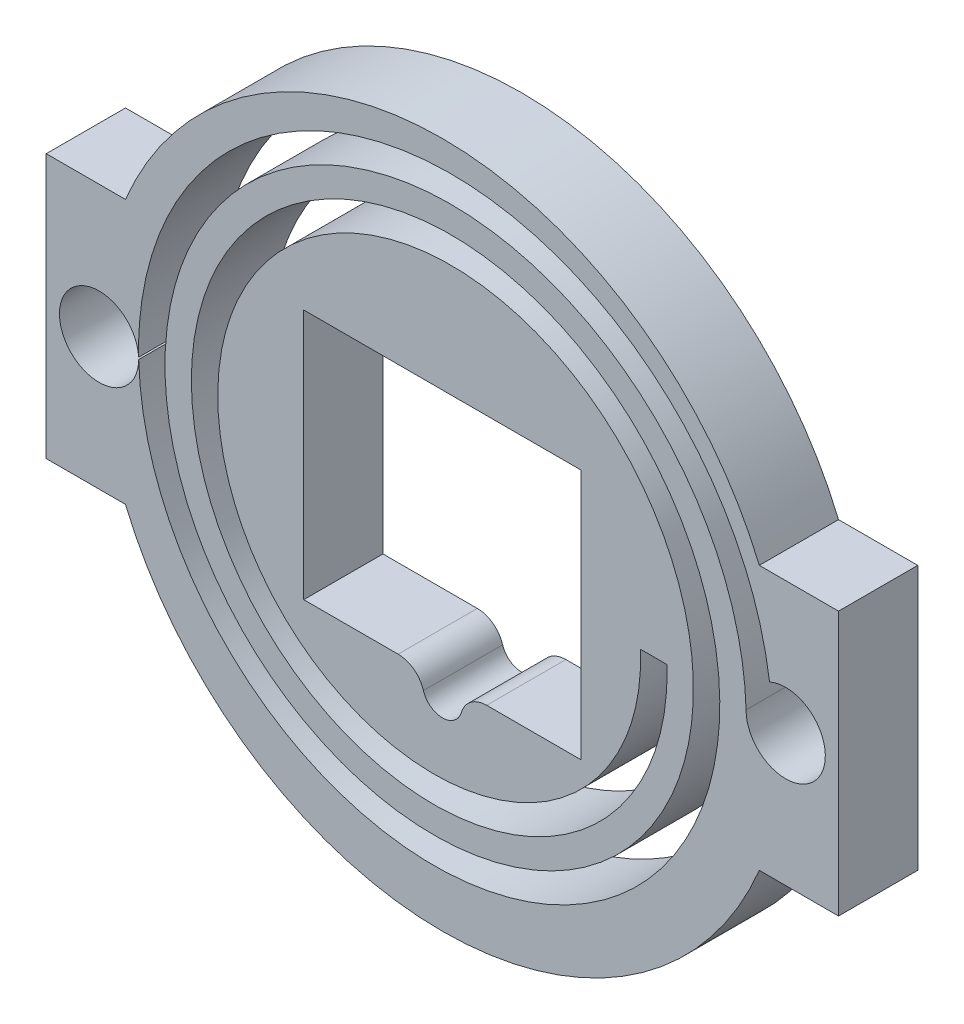
from build123d import *

# Parameters (mm, degrees)
AUFSATZ_LINEAR_AUSTRAGEN1_DEPTH = 3
SCHNITT_AUSTRAGUNG1_DEPTH       = 3
SCHNITT_LINEAR_AUSTRAGEN1_REACH = 37.114
SKIZZE4_W                       = 10.5
SKIZZE4_H                       = 9.5
SCHNITT_LINEAR_AUSTRAGEN2_REACH = 37.114
SKIZZE5_R                       = 1.5
SCHNITT_LINEAR_AUSTRAGEN3_REACH = 37.114
SKIZZE6_R                       = 0.75
VERRUNDUNG1_R                   = 1


# Read off the part's stored shape, not the designer's step: Schnitt-Austragung1
with BuildPart() as part:
    # Skizze1 → Aufsatz-Linear austragen1 (new body)
    with BuildSketch(Plane.XY):
        with BuildLine():
            Line((0, 10), (0, 0))
            Line((0, 0), (3, 0))
            ThreePointArc((3, 0), (2, 5), (3, 10))
            Line((3, 10), (0, 10))
        make_face()
        with BuildLine():
            ThreePointArc((3, 10), (2, 5), (3, 0))
            Line((3, 0), (9.409830056, 0))
            ThreePointArc((9.409830056, 0), (7.5, 5), (9.409830056, 10))
            Line((9.409830056, 10), (3, 10))
        make_face()
        with BuildLine():
            Line((20.590169944, 0), (27, 0))
            ThreePointArc((27, 0), (27.747548784, 2.450490243), (28, 5))
            ThreePointArc((28, 5), (27.747548784, 7.549509757), (27, 10))
            Line((27, 10), (20.590169944, 10))
            ThreePointArc((20.590169944, 10), (22.006292692, 7.676165673), (22.5, 5))
            ThreePointArc((22.5, 5), (22.006292692, 2.323834327), (20.590169944, 0))
        make_face()
        with BuildLine():
            ThreePointArc((27, 10), (15, 18), (3, 10))
            Line((3, 10), (9.409830056, 10))
            ThreePointArc((9.409830056, 10), (15, 12.5), (20.590169944, 10))
            Line((20.590169944, 10), (27, 10))
        make_face()
        with BuildLine():
            Line((9.409830056, 0), (3, 0))
            ThreePointArc((3, 0), (15, -8), (27, 0))
            Line((27, 0), (20.590169944, 0))
            ThreePointArc((20.590169944, 0), (15, -2.5), (9.409830056, 0))
        make_face()
        with BuildLine():
            ThreePointArc((9.409830056, 10), (7.5, 5), (9.409830056, 0))
            Line((9.409830056, 0), (20.590169944, 0))
            ThreePointArc((20.590169944, 0), (22.006292692, 2.323834327), (22.5, 5))
            ThreePointArc((22.5, 5), (22.006292692, 7.676165673), (20.590169944, 10))
            Line((20.590169944, 10), (9.409830056, 10))
        make_face()
        with BuildLine():
            ThreePointArc((28, 5), (27.747548784, 2.450490243), (27, 0))
            Line((27, 0), (30, 0))
            Line((30, 0), (30, 10))
            Line((30, 10), (27, 10))
            ThreePointArc((27, 10), (27.747548784, 7.549509757), (28, 5))
        make_face()
        with BuildLine():
            Line((20.590169944, 0), (9.409830056, 0))
            ThreePointArc((9.409830056, 0), (15, -2.5), (20.590169944, 0))
        make_face()
        with BuildLine():
            ThreePointArc((20.590169944, 10), (15, 12.5), (9.409830056, 10))
            Line((9.409830056, 10), (20.590169944, 10))
        make_face()
    extrude(amount=AUFSATZ_LINEAR_AUSTRAGEN1_DEPTH)

    # Schnitt-Austragung1 outline → Schnitt-Austragung1 (cut)
    with BuildSketch(Plane.XY):
        with BuildLine():
            add(Edge.make_bspline(
                [(23.5, 5), (23.541666666, 3.887352597), (23.362019327, 2.758369508), (22.574902609, 0.640341284), (21.967622011, -0.347821129), (20.40674666, -2.026547542), (19.453673194, -2.716359289), (17.338957731, -3.682502413), (16.178097112, -3.958333357), (13.821902888, -4.041666643), (12.627495566, -3.849005664), (10.388531793, -3.011795804), (9.344905512, -2.367455431), (7.573619036, -0.714020021), (6.846747518, 0.294517317), (5.830511247, 2.530168326), (5.541666645, 3.756453041), (5.458333355, 6.243546959), (5.664007998, 7.503378375), (6.551311001, 9.863277698), (7.232711148, 10.962367847), (8.978706619, 12.826214386), (10.042707827, 13.590145675), (12.399294384, 14.656475092), (13.691003194, 14.958333354), (16.308996806, 15.041666646), (17.634252317, 14.822978339), (20.115087188, 13.885582194), (21.269641206, 13.167122272), (23.226047808, 11.328566742), (24.027038868, 10.209101663), (25.143461431, 7.731579559), (25.458333353, 6.374446653), (25.541666647, 3.625553347), (25.309964676, 2.234873741), (24.322475389, -0.366896679), (23.566955693, -1.576914565), (21.635840103, -3.62588123), (20.460911153, -4.463932062), (17.862453501, -5.630447771), (16.4398965, -5.958333352), (13.5601035, -6.041666648), (12.103999799, -5.796951014), (9.38129383, -4.759368584), (8.115812076, -3.966789114), (5.974285348, -1.943113463), (5.099174745, -0.712720643), (3.88256589, 2.006672557), (3.541666648, 3.494653653), (3.458333352, 6.505346347), (3.716062648, 8.026874142), (4.803738221, 10.87051566), (5.633377466, 12.191461284), (7.749613176, 14.425548074), (9.035469867, 15.337718448), (11.875798614, 16.604420449), (13.429203806, 16.958333351), (16.570796194, 17.041666649), (18.157748084, 16.770923689), (21.122325151, 15.633154974), (22.498734643, 14.766455955), (24.825381496, 12.557660184), (25.774611642, 11.216339623), (27.091406788, 8.255075328), (27.458333332, 6.636246177), (27.5, 5)],
                knots=[0, 0, 0, 0, 0.03125, 0.03125, 0.0625, 0.0625, 0.09375, 0.09375, 0.125, 0.125, 0.15625, 0.15625, 0.1875, 0.1875, 0.21875, 0.21875, 0.25, 0.25, 0.28125, 0.28125, 0.3125, 0.3125, 0.34375, 0.34375, 0.375, 0.375, 0.40625, 0.40625, 0.4375, 0.4375, 0.46875, 0.46875, 0.5, 0.5, 0.53125, 0.53125, 0.5625, 0.5625, 0.59375, 0.59375, 0.625, 0.625, 0.65625, 0.65625, 0.6875, 0.6875, 0.71875, 0.71875, 0.75, 0.75, 0.78125, 0.78125, 0.8125, 0.8125, 0.84375, 0.84375, 0.875, 0.875, 0.90625, 0.90625, 0.9375, 0.9375, 0.96875, 0.96875, 1, 1, 1, 1], degree=3))
            Line((23.5, 5), (22.5, 5))
            add(Edge.make_bspline(
                [(22.5, 5), (22.541666667, 4.020137958), (22.387483723, 3.018945985), (21.702094232, 1.146133005), (21.167313725, 0.266283918), (19.794353268, -1.224928757), (18.949744294, -1.842475601), (17.080440541, -2.707419914), (16.047450739, -2.958059749), (13.956704662, -3.041944567), (12.890057775, -2.875005853), (10.896067143, -2.14000317), (9.960594365, -1.56836807), (8.376425734, -0.103188813), (7.721599213, 0.796759054), (6.806079032, 2.786838804), (6.542181359, 3.885222127), (6.457803141, 6.106903978), (6.637524543, 7.239038309), (7.42218998, 9.354180532), (8.030700632, 10.345260141), (9.588133092, 12.022343442), (10.543432262, 12.71442699), (12.654303394, 13.680473777), (13.818082942, 13.957604625), (16.170696144, 14.042426852), (17.368311264, 13.849899865), (19.604583009, 13.01552942), (20.651255119, 12.370125314), (22.421217943, 10.720410202), (23.150539197, 9.70974908), (24.167070505, 7.4780733), (24.457413426, 6.248895162), (24.542637336, 3.765354289), (24.337285112, 2.502264041), (23.453173337, 0.144881631), (22.770860366, -0.957370704), (21.028837199, -2.820182882), (19.962804919, -3.586725229), (17.610312975, -4.65370482), (16.315734165, -4.957241614), (13.701268713, -5.042830662), (12.372708195, -4.824636208), (9.894231355, -3.890751655), (8.736409395, -3.171516453), (6.780773949, -1.337163167), (5.977024901, -0.215751716), (4.859628453, 2.257566455), (4.542913591, 3.617547774), (4.456991178, 6.362935184), (4.688042655, 7.756961777), (5.671727396, 10.356518968), (6.427896492, 11.569901338), (8.354599186, 13.61833734), (9.531396824, 14.459280543), (12.125550065, 15.627066417), (13.550935526, 15.956945536), (16.427242654, 16.043173515), (17.886731672, 15.79925206), (20.607356926, 14.765743095), (21.876291645, 13.972629864), (24.017508312, 11.953560806), (24.895634664, 10.7213708), (26.113785879, 8.006374677), (26.456817405, 6.515609355), (26.500071657, 5.011971156)],
                knots=[0, 0, 0, 0, 0.03125, 0.03125, 0.0625, 0.0625, 0.09375, 0.09375, 0.125, 0.125, 0.15625, 0.15625, 0.1875, 0.1875, 0.21875, 0.21875, 0.25, 0.25, 0.28125, 0.28125, 0.3125, 0.3125, 0.34375, 0.34375, 0.375, 0.375, 0.40625, 0.40625, 0.4375, 0.4375, 0.46875, 0.46875, 0.5, 0.5, 0.53125, 0.53125, 0.5625, 0.5625, 0.59375, 0.59375, 0.625, 0.625, 0.65625, 0.65625, 0.6875, 0.6875, 0.71875, 0.71875, 0.75, 0.75, 0.78125, 0.78125, 0.8125, 0.8125, 0.84375, 0.84375, 0.875, 0.875, 0.90625, 0.90625, 0.9375, 0.9375, 0.96875, 0.96875, 1, 1, 1, 1], degree=3))
            Line((26.500071657, 5.011971156), (27.5, 5))
        make_face()
    extrude(amount=SCHNITT_AUSTRAGUNG1_DEPTH, mode=Mode.SUBTRACT)

    # Skizze4 → Schnitt-Linear austragen1 (cut, up to next)
    with BuildSketch(Plane.XY.offset(3), mode=Mode.PRIVATE) as schnitt_linear_austragen1_sk1:
        with Locations((15, 5)):
            Rectangle(SKIZZE4_W, SKIZZE4_H)
    schnitt_linear_austragen1_tool1 = extrude(schnitt_linear_austragen1_sk1.sketch, amount=-SCHNITT_LINEAR_AUSTRAGEN1_REACH, mode=Mode.PRIVATE) & part.part
    add(schnitt_linear_austragen1_tool1.solids().sort_by_distance((15, 5, 3))[0], mode=Mode.SUBTRACT)

    # Skizze5 → Schnitt-Linear austragen2 (cut, up to next)
    with BuildSketch(Plane.XY.offset(3), mode=Mode.PRIVATE) as schnitt_linear_austragen2_sk1:
        with Locations((2, 5)):
            Circle(SKIZZE5_R)
    schnitt_linear_austragen2_tool1 = extrude(schnitt_linear_austragen2_sk1.sketch, amount=-SCHNITT_LINEAR_AUSTRAGEN2_REACH, mode=Mode.PRIVATE) & part.part
    # Skizze5 → Schnitt-Linear austragen2 (cut, up to next)
    with BuildSketch(Plane.XY.offset(3), mode=Mode.PRIVATE) as schnitt_linear_austragen2_sk2:
        with Locations((28, 5)):
            Circle(SKIZZE5_R)
    schnitt_linear_austragen2_tool2 = extrude(schnitt_linear_austragen2_sk2.sketch, amount=-SCHNITT_LINEAR_AUSTRAGEN2_REACH, mode=Mode.PRIVATE) & part.part
    add(schnitt_linear_austragen2_tool1.solids().sort_by_distance((2, 5, 3))[0], mode=Mode.SUBTRACT)
    add(schnitt_linear_austragen2_tool2.solids().sort_by_distance((28, 5, 3))[0], mode=Mode.SUBTRACT)

    # Skizze6 → Schnitt-Linear austragen3 (cut, up to next)
    with BuildSketch(Plane.XY.offset(3), mode=Mode.PRIVATE) as schnitt_linear_austragen3_sk1:
        with Locations((15, -0.25)):
            Circle(SKIZZE6_R)
    schnitt_linear_austragen3_tool1 = extrude(schnitt_linear_austragen3_sk1.sketch, amount=-SCHNITT_LINEAR_AUSTRAGEN3_REACH, mode=Mode.PRIVATE) & part.part
    add(schnitt_linear_austragen3_tool1.solids().sort_by_distance((15, -0.25, 3))[0], mode=Mode.SUBTRACT)

    # Verrundung1
    verrundung1_edges = [part.edges().sort_by_distance(p)[0] for p in [
        (15.559016994, 0.25, 1.5),
        (14.440983006, 0.25, 1.5),
    ]]
    fillet(verrundung1_edges, radius=VERRUNDUNG1_R)


solid = part.part
